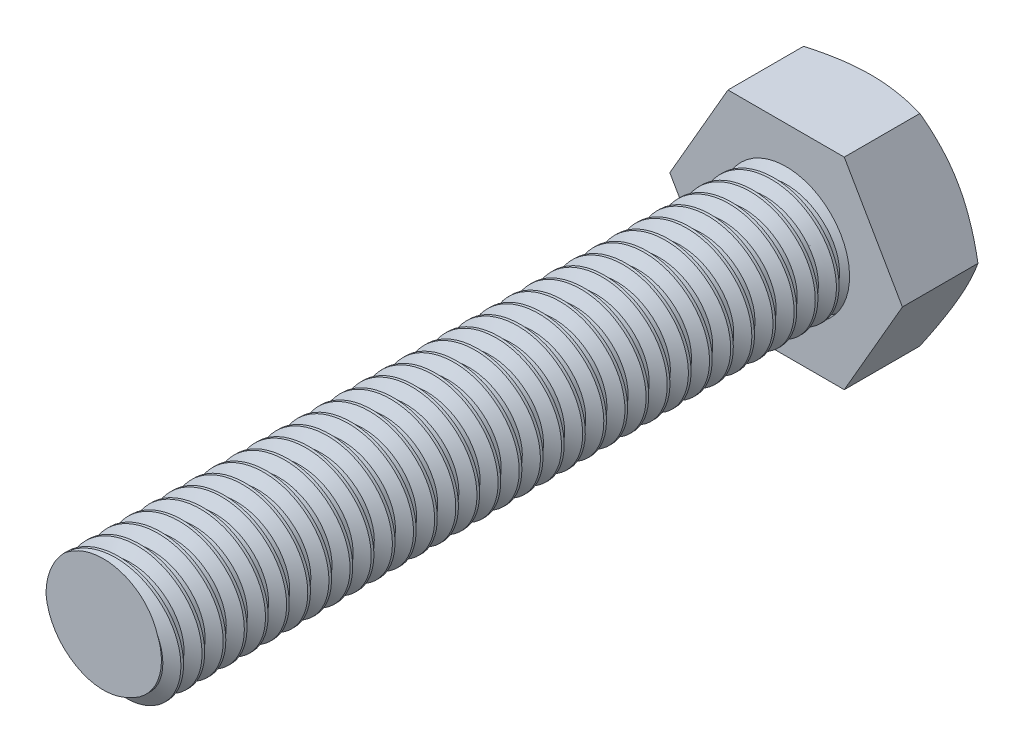
from build123d import *

# Parameters (mm, degrees)
BOSS_EXTRUDE1_DEPTH      = 1
BOSS_EXTRUDE1_DEPTH_BACK = 1
SKETCH2_R                = 1.5
BOSS_EXTRUDE2_DEPTH      = 16
THREAD1_PITCH            = 0.5
SKETCH24_OUTSIDE_W       = 13.982
SKETCH24_OUTSIDE_H       = 13.246
SKETCH24_OUTSIDE_R       = 2.38156986
CUT_EXTRUDE3_DEPTH       = 0.75
CUT_EXTRUDE3_DRAFT       = -60


with BuildPart() as part:
    # Sketch1 → Boss-Extrude1 (new, two sides: drawn at the far end of the back side and taken through both)
    with BuildSketch(Plane.XY.offset(-BOSS_EXTRUDE1_DEPTH_BACK)):
        Polygon((1.375, 2.38156986), (-1.375, 2.38156986), (-2.75, 0), (-1.375, -2.38156986), (1.375, -2.38156986), (2.75, 0), align=None)
    extrude(amount=BOSS_EXTRUDE1_DEPTH + BOSS_EXTRUDE1_DEPTH_BACK)

    # Sketch2 → Boss-Extrude2 (add)
    with BuildSketch(Plane.XY.offset(1)):
        Circle(SKETCH2_R)
    extrude(amount=BOSS_EXTRUDE2_DEPTH)

    # Thread1: the profile of Thread Profile1 profile screwed along a right-hand helix of 34 turns, 6 arcs to a turn; built about Z, then put on its axis
    thread1_z = Axis((0, 0, 0), (0, 0, 1))
    thread1_corners = [(1.5003, 0, -0.000173205), (1.5003, 0, 0.437673204), (1.229367063, 0, 0.281249999), (1.229367063, 0, 0.156249999)]
    with BuildLine(mode=Mode.PRIVATE) as thread1_profile:
        Line(thread1_corners[0], thread1_corners[1])
        Line(thread1_corners[1], thread1_corners[2])
        Line(thread1_corners[2], thread1_corners[3])
        Line(thread1_corners[3], thread1_corners[0])
    thread1_cap = Face(thread1_profile.wire())
    thread1_turn_angles = [0, 30, 60, 90, 120, 150, 180, 210, 240, 270, 300, 330, 360]
    thread1_turn_weights = [1, 0.8660254037844387, 1, 0.8660254037844387, 1, 0.8660254037844387, 1, 0.8660254037844387, 1, 0.8660254037844387, 1, 0.8660254037844387, 1]
    thread1_turn_rails = [Edge.make_bspline([Vector(p[0], p[1], 0).rotate(thread1_z, thread1_turn_angles[k]) / thread1_turn_weights[k] + Vector(0, 0, p[2] + THREAD1_PITCH * thread1_turn_angles[k] / 360) for k in range(13)], [0, 0, 0, 1, 1, 2, 2, 3, 3, 4, 4, 5, 5, 6, 6, 6], 2, thread1_turn_weights) for p in thread1_corners]
    thread1_turn_sides = [Face.make_surface_from_curves(thread1_turn_rails[p[0]], thread1_turn_rails[p[1]]) for p in [(0, 1), (1, 2), (2, 3), (3, 0)]]
    thread1 = Plane(origin=(0, 0, 18), x_dir=(-1, 0, 0), z_dir=(0, 0, -1)) * Solid(Shell([*[p.moved(Location((0, 0, THREAD1_PITCH * i))) for i in range(34) for p in thread1_turn_sides], thread1_cap, thread1_cap.rotate(thread1_z, 12240).moved(Location((0, 0, THREAD1_PITCH * 12240 / 360)))]))
    add(thread1, mode=Mode.SUBTRACT)


with BuildPart() as cut_extrude3_tool:
    # Sketch24 outside → Cut-Extrude3 (with draft: the straight prism first)
    with BuildSketch(Plane(origin=(0, 0, -1), x_dir=(-1, 0, 0), z_dir=(0, 0, -1))):
        Rectangle(SKETCH24_OUTSIDE_W, SKETCH24_OUTSIDE_H)
        Circle(SKETCH24_OUTSIDE_R, mode=Mode.SUBTRACT)
    extrude(amount=-CUT_EXTRUDE3_DEPTH)
    # Cut-Extrude3: the draft: its side faces are tilted about the plane it starts from
    cut_extrude3_sides = [cut_extrude3_tool.faces().sort_by_distance(p)[0] for p in [
        (0, -6.623, -0.625),
        (-6.991, 0, -0.625),
        (0, 6.623, -0.625),
        (6.991, 0, -0.625),
        (2.38156986, 0, -0.625),
    ]]
    draft(cut_extrude3_sides, Plane(origin=(0, 0, -1), x_dir=(-1, 0, 0), z_dir=(0, 0, -1)), CUT_EXTRUDE3_DRAFT)


with BuildPart() as part_1:
    add(part.part)

    # Cut-Extrude3: cut by cut_extrude3_tool
    add(cut_extrude3_tool.part, mode=Mode.SUBTRACT)


solid = part_1.part
